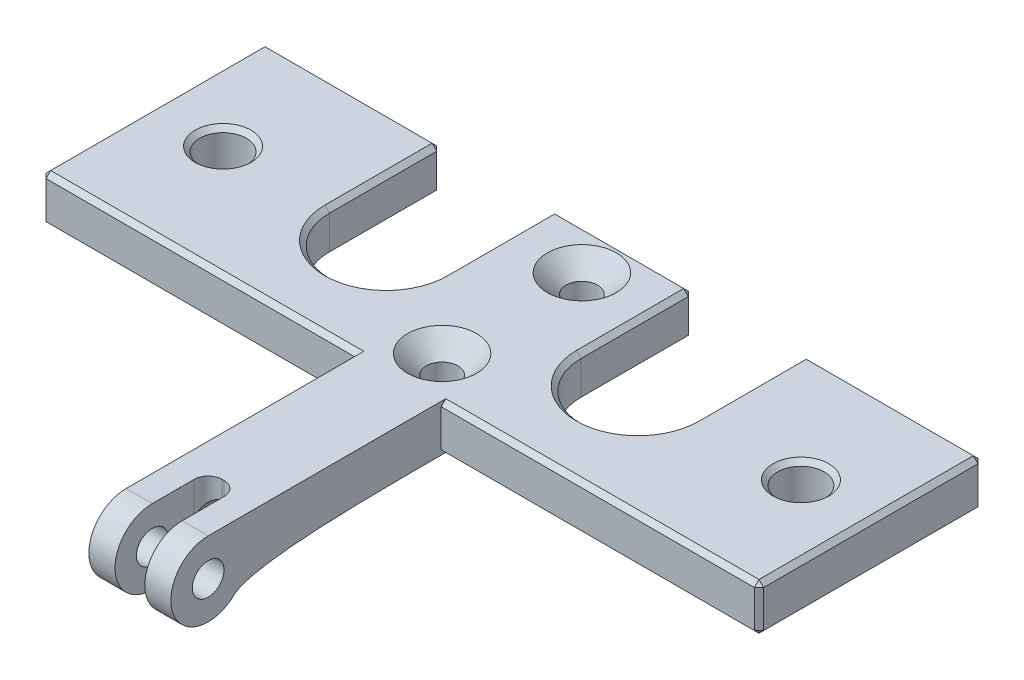
from build123d import *

# Parameters (mm, degrees)
SKETCH1_R           = 2.5
SKETCH1_R_2         = 1.7
BOSS_EXTRUDE1_DEPTH = 5
CHAMFER2_SIZE       = 2
CUT_EXTRUDE1_DEPTH  = 0.4
CHAMFER3_SIZE       = 0.5
BOSS_EXTRUDE3_START = 1.6
SKETCH4_R           = 1.7
BOSS_EXTRUDE3_DEPTH = 2.8
BOSS_EXTRUDE4_START = -4.4
SKETCH4_2_R         = 1.7
BOSS_EXTRUDE4_DEPTH = 2.8
SKETCH5_W           = 3.2
SKETCH5_H           = 19.5
BOSS_EXTRUDE5_DEPTH = 2
FILLET1_R           = 1.5


with BuildPart() as part:
    # Sketch1 → Boss-Extrude1 (new body)
    with BuildSketch(Plane(origin=(0, 0, 0), x_dir=(1, 0, 0), z_dir=(0, 1, 0))):
        with BuildLine():
            Line((-38.5, -12), (38.5, -12))
            Line((38.5, -12), (38.5, 12))
            Line((38.5, 12), (19.575, 12))
            Line((19.575, 12), (19.575, 0))
            ThreePointArc((19.575, 0), (13.5, -6.075), (7.425, 0))
            Line((7.425, 0), (7.425, 12))
            Line((7.425, 12), (-7.425, 12))
            Line((-7.425, 12), (-7.425, 0))
            ThreePointArc((-7.425, 0), (-13.5, -6.075), (-19.575, 0))
            Line((-19.575, 0), (-19.575, 12))
            Line((-19.575, 12), (-38.5, 12))
            Line((-38.5, 12), (-38.5, -12))
        make_face()
        with Locations((-31, 0)):
            Circle(SKETCH1_R, mode=Mode.SUBTRACT)
        with Locations((0, -7.5)):
            Circle(SKETCH1_R_2, mode=Mode.SUBTRACT)
        with Locations((31, 0)):
            Circle(SKETCH1_R, mode=Mode.SUBTRACT)
        with Locations((0, 7.5)):
            Circle(SKETCH1_R_2, mode=Mode.SUBTRACT)
    extrude(amount=BOSS_EXTRUDE1_DEPTH)

    # Chamfer2
    chamfer2_edges = [part.edges().sort_by_distance(p)[0] for p in [
        (-1.7, 5, -7.5),
        (-1.7, 5, 7.5),
    ]]
    chamfer(chamfer2_edges, length=CHAMFER2_SIZE)

    # Sketch2 → Cut-Extrude1 (cut)
    with BuildSketch(Plane.XZ):
        with BuildLine():
            Line((-5.025, 0), (-5.025, -12))
            Line((-5.025, -12), (-21.975, -12))
            Line((-21.975, -12), (-21.975, 0))
            ThreePointArc((-21.975, 0), (-13.5, 8.475), (-5.025, 0))
        make_face()
        with BuildLine():
            Line((21.975, -12), (5.025, -12))
            Line((5.025, -12), (5.025, 0))
            ThreePointArc((5.025, 0), (13.5, 8.475), (21.975, 0))
            Line((21.975, 0), (21.975, -12))
        make_face()
    extrude(amount=-CUT_EXTRUDE1_DEPTH, mode=Mode.SUBTRACT)

    # Chamfer3
    chamfer3_edges = [part.edges().sort_by_distance(p)[0] for p in [
        (-33.5, 0, 0),
        (-33.5, 5, 0),
        (28.5, 0, 0),
        (28.5, 5, 0),
        (19.575, 5, -6),
        (7.425, 5, -6),
        (13.5, 5, 6.075),
        (38.5, 5, 0),
        (0, 5, 12),
        (38.5, 2.5, 12),
        (-38.5, 5, 0),
        (-38.5, 2.5, 12),
        (-19.575, 2.7, -12),
        (-29.0375, 5, -12),
        (-38.5, 2.5, -12),
        (-30.2375, 0, -12),
        (-38.5, 0, 0),
        (0, 0, 12),
        (38.5, 0, 0),
        (38.5, 2.5, -12),
        (29.0375, 5, -12),
        (19.575, 2.7, -12),
        (30.2375, 0, -12),
        (7.425, 2.7, -12),
        (0, 5, -12),
        (-7.425, 2.7, -12),
        (-19.575, 5, -6),
        (-7.425, 5, -6),
        (-13.5, 5, 6.075),
        (-1.7, 0, 7.5),
        (-1.7, 0, -7.5),
        (7.425, 0.4, -6),
        (19.575, 0.4, -6),
        (13.5, 0.4, 6.075),
        (-20.775, 0.4, -12),
        (-21.975, 0.2, -12),
        (20.775, 0.4, -12),
        (21.975, 0.2, -12),
        (5.025, 0.2, -12),
        (6.225, 0.4, -12),
        (-6.225, 0.4, -12),
        (-5.025, 0.2, -12),
        (0, 0, -12),
        (-7.425, 0.4, -6),
        (-19.575, 0.4, -6),
        (-13.5, 0.4, 6.075),
    ]]
    chamfer(chamfer3_edges, length=CHAMFER3_SIZE)

    # Sketch4 → Boss-Extrude3 (add)
    with BuildSketch(Plane(origin=(0, 0, 0), x_dir=(0, 0, -1), z_dir=(1, 0, 0)).offset(BOSS_EXTRUDE3_START)):
        with BuildLine():
            Line((-37, 5), (-11.5, 5))
            Line((-11.5, 5), (-11.5, 0))
            add(Edge.make_bspline(
                [(-11.5, 0), (-17.519165816, 0), (-32.11754758, 0.119777192), (-34.245938776, -1.900887239)],
                knots=[0, 0, 0, 0, 1, 1, 1, 1], degree=3))
            ThreePointArc((-34.245938776, -1.900887239), (-40.715073953, -0.4826414), (-37, 5))
        make_face()
        with Locations((-37, 1)):
            Circle(SKETCH4_R, mode=Mode.SUBTRACT)
    extrude(amount=BOSS_EXTRUDE3_DEPTH)

    # Sketch4<2> → Boss-Extrude4 (add)
    with BuildSketch(Plane(origin=(0, 0, 0), x_dir=(0, 0, -1), z_dir=(1, 0, 0)).offset(BOSS_EXTRUDE4_START)):
        with BuildLine():
            Line((-37, 5), (-11.5, 5))
            Line((-11.5, 5), (-11.5, 0))
            add(Edge.make_bspline(
                [(-11.5, 0), (-17.519165816, 0), (-32.11754758, 0.119777192), (-34.245938776, -1.900887239)],
                knots=[0, 0, 0, 0, 1, 1, 1, 1], degree=3))
            ThreePointArc((-34.245938776, -1.900887239), (-40.715073953, -0.4826414), (-37, 5))
        make_face()
        with Locations((-37, 1)):
            Circle(SKETCH4_2_R, mode=Mode.SUBTRACT)
    extrude(amount=BOSS_EXTRUDE4_DEPTH)

    # Sketch5 → Boss-Extrude5 (add)
    with BuildSketch(Plane(origin=(0, 5, 0), x_dir=(1, 0, 0), z_dir=(0, 1, 0))):
        with Locations((0, -21.25)):
            Rectangle(SKETCH5_W, SKETCH5_H)
    extrude(amount=-BOSS_EXTRUDE5_DEPTH)

    # Fillet1
    fillet1_edges = [part.edges().sort_by_distance(p)[0] for p in [
        (0, 3, 12),
        (1.6, 3, 21.5),
        (-1.6, 3, 21.5),
        (-1.6, 4, 31),
        (1.6, 4, 31),
    ]]
    fillet(fillet1_edges, radius=FILLET1_R)


solid = part.part
